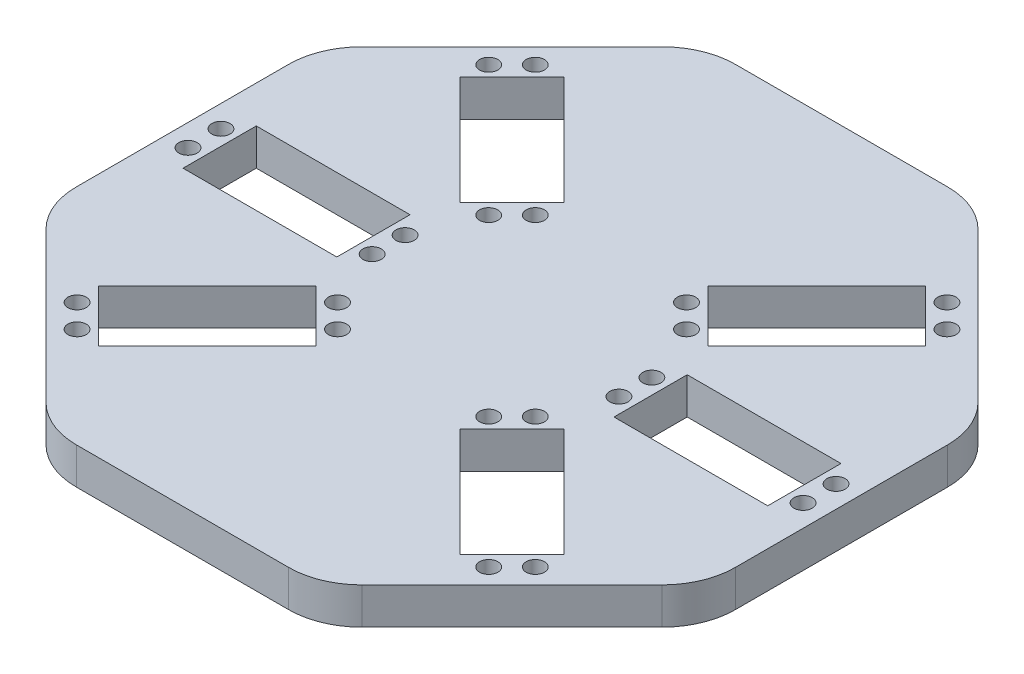
from build123d import *

# Parameters (mm, degrees)
SKETCH1_R           = 2.5
SKETCH1_W           = 42
SKETCH1_H           = 20
BOSS_EXTRUDE1_DEPTH = 10
FILLET1_R           = 20


with BuildPart() as part:
    # Sketch1 → Boss-Extrude1 (new body)
    with BuildSketch(Plane(origin=(0, 0, 0), x_dir=(1, 0, 0), z_dir=(0, 1, 0))):
        Polygon((-90, 37.279220614), (-90, -37.279220614), (-37.279220614, -90), (37.279220614, -90), (90, -37.279220614), (90, 37.279220614), (37.279220614, 90), (-37.279220614, 90), align=None)
        with Locations((20.647518011, -27.011479041)):
            Circle(SKETCH1_R, mode=Mode.SUBTRACT)
        with Locations((27.011479041, -20.647518011)):
            Circle(SKETCH1_R, mode=Mode.SUBTRACT)
        Polygon((33.83505948, -19.692923856), (63.53354429, -49.391408666), (49.391408666, -63.53354429), (19.692923856, -33.83505948), align=None, mode=Mode.SUBTRACT)
        with Locations((-56.214989104, -62.578950135)):
            Circle(SKETCH1_R, mode=Mode.SUBTRACT)
        with Locations((-62.578950135, -56.214989104)):
            Circle(SKETCH1_R, mode=Mode.SUBTRACT)
        with Locations((-84, -4.5)):
            Circle(SKETCH1_R, mode=Mode.SUBTRACT)
        Polygon((-33.83505948, -19.692923856), (-19.692923856, -33.83505948), (-49.391408666, -63.53354429), (-63.53354429, -49.391408666), align=None, mode=Mode.SUBTRACT)
        with Locations((-20.647518011, -27.011479041)):
            Circle(SKETCH1_R, mode=Mode.SUBTRACT)
        with Locations((-27.011479041, -20.647518011)):
            Circle(SKETCH1_R, mode=Mode.SUBTRACT)
        with Locations((-33.7, -4.5)):
            Circle(SKETCH1_R, mode=Mode.SUBTRACT)
        with Locations((56.214989104, -62.578950135)):
            Circle(SKETCH1_R, mode=Mode.SUBTRACT)
        with Locations((62.578950135, -56.214989104)):
            Circle(SKETCH1_R, mode=Mode.SUBTRACT)
        with Locations((62.578950135, 56.214989104)):
            Circle(SKETCH1_R, mode=Mode.SUBTRACT)
        with Locations((56.214989104, 62.578950135)):
            Circle(SKETCH1_R, mode=Mode.SUBTRACT)
        with Locations((33.7, -4.5)):
            Circle(SKETCH1_R, mode=Mode.SUBTRACT)
        with Locations((58.85, 0)):
            Rectangle(SKETCH1_W, SKETCH1_H, mode=Mode.SUBTRACT)
        with Locations((84, -4.5)):
            Circle(SKETCH1_R, mode=Mode.SUBTRACT)
        with Locations((-84, 4.5)):
            Circle(SKETCH1_R, mode=Mode.SUBTRACT)
        with Locations((-58.85, 0)):
            Rectangle(SKETCH1_W, SKETCH1_H, mode=Mode.SUBTRACT)
        with Locations((-33.7, 4.5)):
            Circle(SKETCH1_R, mode=Mode.SUBTRACT)
        with Locations((-27.011479041, 20.647518011)):
            Circle(SKETCH1_R, mode=Mode.SUBTRACT)
        Polygon((-19.692923856, 33.83505948), (-33.83505948, 19.692923856), (-63.53354429, 49.391408666), (-49.391408666, 63.53354429), align=None, mode=Mode.SUBTRACT)
        with Locations((-20.647518011, 27.011479041)):
            Circle(SKETCH1_R, mode=Mode.SUBTRACT)
        with Locations((-62.578950135, 56.214989104)):
            Circle(SKETCH1_R, mode=Mode.SUBTRACT)
        with Locations((-56.214989104, 62.578950135)):
            Circle(SKETCH1_R, mode=Mode.SUBTRACT)
        with Locations((33.7, 4.5)):
            Circle(SKETCH1_R, mode=Mode.SUBTRACT)
        with Locations((27.011479041, 20.647518011)):
            Circle(SKETCH1_R, mode=Mode.SUBTRACT)
        with Locations((20.647518011, 27.011479041)):
            Circle(SKETCH1_R, mode=Mode.SUBTRACT)
        Polygon((33.83505948, 19.692923856), (19.692923856, 33.83505948), (49.391408666, 63.53354429), (63.53354429, 49.391408666), align=None, mode=Mode.SUBTRACT)
        with Locations((84, 4.5)):
            Circle(SKETCH1_R, mode=Mode.SUBTRACT)
    extrude(amount=BOSS_EXTRUDE1_DEPTH)

    # Fillet1
    fillet1_edges = [part.edges().sort_by_distance(p)[0] for p in [
        (-90, 5, -37.279220614),
        (-37.279220614, 5, -90),
        (37.279220614, 5, -90),
        (90, 5, -37.279220614),
        (90, 5, 37.279220614),
        (37.279220614, 5, 90),
        (-37.279220614, 5, 90),
        (-90, 5, 37.279220614),
    ]]
    fillet(fillet1_edges, radius=FILLET1_R)


solid = part.part
